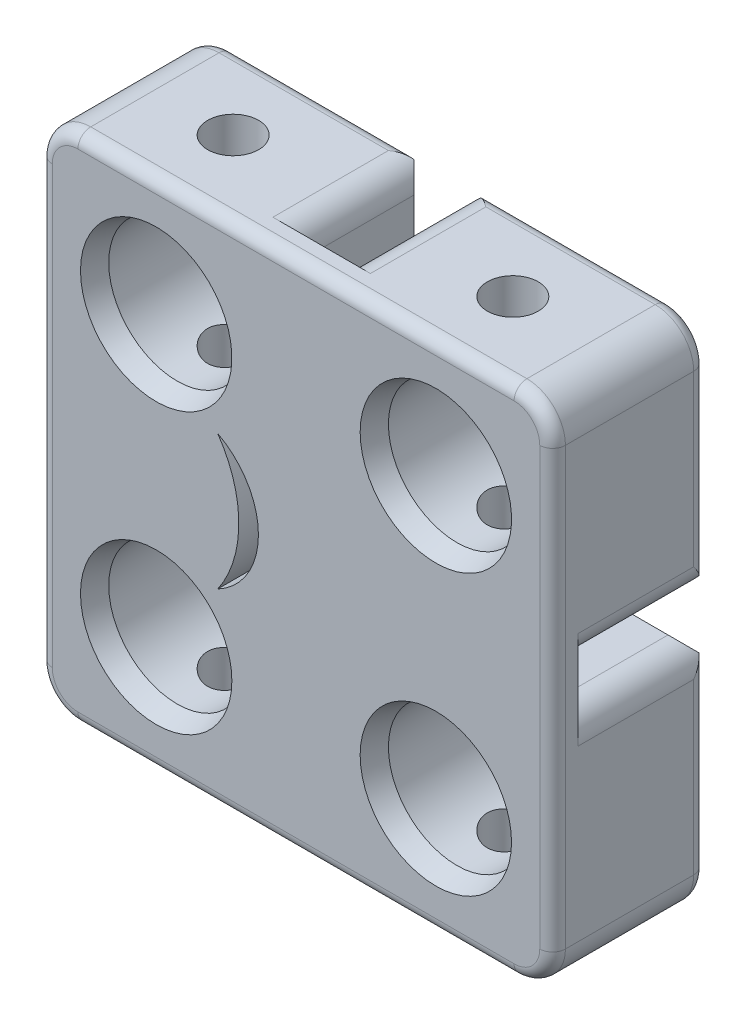
from build123d import *

# Parameters (mm, degrees)
SKETCH1_W           = 50.8
SKETCH1_H           = 50.8
BOSS_EXTRUDE1_DEPTH = 15.24
CUT_EXTRUDE1_DEPTH  = 12.7
SKETCH3_R           = 2.521712
CUT_EXTRUDE2_DEPTH  = 74.440708058
SKETCH4_R           = 6.773333333
CUT_EXTRUDE3_DEPTH  = 74.440708058
CUT_EXTRUDE4_DEPTH  = 12.7
CUT_EXTRUDE7_DEPTH  = 74.440708148
CHAMFER1_SIZE       = 1.27
FILLET2_R           = 1.27
FILLET3_R           = 3.81
FILLET4_R           = 2.54


with BuildPart() as part:
    # Sketch1 → Boss-Extrude1 (new body)
    with BuildSketch(Plane.XY):
        with Locations((25.4, 25.4)):
            Rectangle(SKETCH1_W, SKETCH1_H)
    extrude(amount=BOSS_EXTRUDE1_DEPTH)

    # Sketch2 → Cut-Extrude1 (cut)
    with BuildSketch(Plane(origin=(0, 0, 0), x_dir=(-1, 0, 0), z_dir=(0, 0, -1))):
        Polygon((-27.686, 50.8), (-23.114, 50.8), (-23.114, 27.686), (0, 27.686), (0, 23.114), (-23.114, 23.114), (-23.114, 0), (-27.686, 0), (-27.686, 23.114), (-50.8, 23.114), (-50.8, 27.686), (-27.686, 27.686), align=None)
    extrude(amount=-CUT_EXTRUDE1_DEPTH, mode=Mode.SUBTRACT)

    # Sketch3 → Cut-Extrude2 (cut, through all)
    with BuildSketch(Plane(origin=(0, 50.8, 0), x_dir=(1, 0, 0), z_dir=(0, 1, 0))):
        with Locations(Location((11.557, -7.62, 0), (0, 0, 270))):
            Circle(SKETCH3_R)
        with Locations(Location((39.243, -7.62, 0), (0, 0, 270))):
            Circle(SKETCH3_R)
    extrude(amount=-CUT_EXTRUDE2_DEPTH, mode=Mode.SUBTRACT)

    # Sketch4 → Cut-Extrude3 (cut, through all)
    with BuildSketch(Plane(origin=(0, 0, 0), x_dir=(-1, 0, 0), z_dir=(0, 0, -1))):
        with Locations((-39.243, 39.243)):
            Circle(SKETCH4_R)
        with Locations((-11.557, 39.243)):
            Circle(SKETCH4_R)
        with Locations((-11.557, 11.557)):
            Circle(SKETCH4_R)
        with Locations((-39.243, 11.557)):
            Circle(SKETCH4_R)
    extrude(amount=-CUT_EXTRUDE3_DEPTH, mode=Mode.SUBTRACT)

    # Sketch5 → Cut-Extrude4 (cut)
    with BuildSketch(Plane(origin=(0, 0, 0), x_dir=(-1, 0, 0), z_dir=(0, 0, -1))):
        Polygon((-25.4, 32.584204897), (-32.584204897, 25.4), (-25.4, 18.215795103), (-18.215795103, 25.4), align=None)
    extrude(amount=-CUT_EXTRUDE4_DEPTH, mode=Mode.SUBTRACT)

    # Sketch6 → Cut-Extrude7 (cut, through all)
    with BuildSketch(Plane.XY.offset(15.24)):
        with BuildLine():
            ThreePointArc((17.643786224, 32.072270857), (19.737124378, 25.4), (17.643786224, 18.727729143))
            ThreePointArc((17.643786224, 18.727729143), (21.677945484, 25.4), (17.643786224, 32.072270857))
        make_face()
    extrude(amount=-CUT_EXTRUDE7_DEPTH, mode=Mode.SUBTRACT)

    # Sketch10 → Cut-Revolve1 (revolve, cut)
    with BuildSketch(Plane(origin=(11.557, 0, 0), x_dir=(0, 0, -1), z_dir=(1, 0, 0)), mode=Mode.PRIVATE) as cut_revolve1_sk:
        Polygon((-15.24, 45.593), (-11.938, 45.593), (-15.24, 46.736), align=None)
    revolve(cut_revolve1_sk.sketch.rotate(Axis((11.557, 39.243, 0), (0, 0, 1)), 90), axis=Axis((11.557, 39.243, 0), (0, 0, 1)), mode=Mode.SUBTRACT)

    # Sketch13 → Cut-Revolve2 (revolve, cut)
    with BuildSketch(Plane(origin=(11.557, 0, 0), x_dir=(0, 0, -1), z_dir=(1, 0, 0)), mode=Mode.PRIVATE) as cut_revolve2_sk:
        Polygon((-15.24, 17.907), (-11.938, 17.907), (-15.24, 19.05), align=None)
    revolve(cut_revolve2_sk.sketch.rotate(Axis((11.557, 11.557, 0), (0, 0, 1)), 90), axis=Axis((11.557, 11.557, 0), (0, 0, 1)), mode=Mode.SUBTRACT)

    # Sketch14 → Cut-Revolve3 (revolve, cut)
    with BuildSketch(Plane.ZY.offset(-39.243), mode=Mode.PRIVATE) as cut_revolve3_sk:
        Polygon((11.938, 45.593), (15.24, 45.593), (15.24, 46.736), align=None)
    revolve(cut_revolve3_sk.sketch.rotate(Axis((39.243, 39.243, 0), (0, 0, 1)), 90), axis=Axis((39.243, 39.243, 0), (0, 0, 1)), mode=Mode.SUBTRACT)

    # Sketch15 → Cut-Revolve4 (revolve, cut)
    with BuildSketch(Plane.ZY.offset(-39.243), mode=Mode.PRIVATE) as cut_revolve4_sk:
        Polygon((15.24, 17.907), (11.938, 17.907), (15.24, 19.05), align=None)
    revolve(cut_revolve4_sk.sketch.rotate(Axis((39.243, 11.557, 0), (0, 0, 1)), 90), axis=Axis((39.243, 11.557, 0), (0, 0, 1)), mode=Mode.SUBTRACT)

    # Chamfer1
    chamfer1_edges = [part.edges().sort_by_distance(p)[0] for p in [
        (40.549102448, 27.686, 0),
        (27.686, 10.250897552, 0),
        (23.114, 40.549102448, 0),
        (22.108442913, 21.507352191, 0),
        (28.992102448, 21.807897552, 0),
        (28.992102448, 28.992102448, 0),
        (22.108442913, 29.292647809, 0),
        (9.755618574, 23.114, 0),
        (27.686, 40.549102448, 0),
        (40.549102448, 23.114, 0),
        (23.114, 10.250897552, 0),
        (9.755618574, 27.686, 0),
    ]]
    chamfer(chamfer1_edges, length=CHAMFER1_SIZE)

    # Fillet2
    fillet2_edges = [part.edges().sort_by_distance(p)[0] for p in [
        (10.922, 0, 0),
        (0, 10.922, 0),
        (0, 39.878, 0),
        (10.922, 50.8, 0),
        (39.878, 50.8, 0),
        (50.8, 39.878, 0),
        (39.878, 0, 0),
        (50.8, 10.922, 0),
        (0, 25.4, 15.24),
        (50.8, 25.4, 15.24),
        (25.4, 0, 15.24),
        (25.4, 50.8, 15.24),
    ]]
    fillet(fillet2_edges, radius=FILLET2_R)

    # Fillet3
    # the kernel refuses this fillet: 3.81 mm, written as the material it takes off along each edge
    with BuildSketch(Plane(origin=(3.81, 3.81, 0), x_dir=(0, -1, 0), z_dir=(1, 0, 0))) as fillet3_piece_1:
        with BuildLine():
            CenterArc((2.54, -1.27), 1.27, 0, 90)
            Line((3.81, -1.27), (3.81, 0))
            Line((3.81, 0), (2.54, 0))
        make_face()
    revolve(axis=Axis((3.81, 3.81, 0), (0, 0, -1)), revolution_arc=90, mode=Mode.SUBTRACT)
    with BuildSketch(Plane(origin=(3.81, 46.99, 0), x_dir=(-1, 0, 0), z_dir=(0, -1, 0))) as fillet3_piece_2:
        with BuildLine():
            CenterArc((2.54, -1.27), 1.27, 0, 90)
            Line((3.81, -1.27), (3.81, 0))
            Line((3.81, 0), (2.54, 0))
        make_face()
    revolve(axis=Axis((3.81, 46.99, 0), (0, 0, -1)), revolution_arc=90, mode=Mode.SUBTRACT)
    with BuildSketch(Plane(origin=(46.99, 46.99, 0), x_dir=(0, 1, 0), z_dir=(-1, 0, 0))) as fillet3_piece_3:
        with BuildLine():
            CenterArc((2.54, -1.27), 1.27, 0, 90)
            Line((3.81, -1.27), (3.81, 0))
            Line((3.81, 0), (2.54, 0))
        make_face()
    revolve(axis=Axis((46.99, 46.99, 0), (0, 0, -1)), revolution_arc=90, mode=Mode.SUBTRACT)
    with BuildSketch(Plane(origin=(46.99, 3.81, 0), x_dir=(1, 0, 0), z_dir=(0, 1, 0))) as fillet3_piece_4:
        with BuildLine():
            CenterArc((2.54, -1.27), 1.27, 0, 90)
            Line((3.81, -1.27), (3.81, 0))
            Line((3.81, 0), (2.54, 0))
        make_face()
    revolve(axis=Axis((46.99, 3.81, 0), (0, 0, -1)), revolution_arc=90, mode=Mode.SUBTRACT)
    with BuildSketch(Plane(origin=(46.99, 46.99, 15.24), x_dir=(1, 0, 0), z_dir=(0, -1, 0))) as fillet3_piece_5:
        with BuildLine():
            CenterArc((2.54, -1.27), 1.27, 0, 90)
            Line((3.81, -1.27), (3.81, 0))
            Line((3.81, 0), (2.54, 0))
        make_face()
    revolve(axis=Axis((46.99, 46.99, 15.24), (0, 0, 1)), revolution_arc=90, mode=Mode.SUBTRACT)
    with BuildSketch(Plane(origin=(46.99, 3.81, 15.24), x_dir=(0, -1, 0), z_dir=(-1, 0, 0))) as fillet3_piece_6:
        with BuildLine():
            CenterArc((2.54, -1.27), 1.27, 0, 90)
            Line((3.81, -1.27), (3.81, 0))
            Line((3.81, 0), (2.54, 0))
        make_face()
    revolve(axis=Axis((46.99, 3.81, 15.24), (0, 0, 1)), revolution_arc=90, mode=Mode.SUBTRACT)
    with BuildSketch(Plane(origin=(3.81, 46.99, 15.24), x_dir=(0, 1, 0), z_dir=(1, 0, 0))) as fillet3_piece_7:
        with BuildLine():
            CenterArc((2.54, -1.27), 1.27, 0, 90)
            Line((3.81, -1.27), (3.81, 0))
            Line((3.81, 0), (2.54, 0))
        make_face()
    revolve(axis=Axis((3.81, 46.99, 15.24), (0, 0, 1)), revolution_arc=90, mode=Mode.SUBTRACT)
    with BuildSketch(Plane(origin=(3.81, 3.81, 15.24), x_dir=(-1, 0, 0), z_dir=(0, 1, 0))) as fillet3_piece_8:
        with BuildLine():
            CenterArc((2.54, -1.27), 1.27, 0, 90)
            Line((3.81, -1.27), (3.81, 0))
            Line((3.81, 0), (2.54, 0))
        make_face()
    revolve(axis=Axis((3.81, 3.81, 15.24), (0, 0, 1)), revolution_arc=90, mode=Mode.SUBTRACT)
    with BuildSketch(Plane(origin=(50.8, 0, 0), x_dir=(-1, 0, 0), z_dir=(0, 0, 1)), Plane(origin=(50.8, 50.8, 0), x_dir=(0, -1, 0), z_dir=(0, 0, 1))) as fillet3_piece_9:
        with BuildLine():
            CenterArc((FILLET3_R, -FILLET3_R), FILLET3_R, 90, 90)
            Line((0, -FILLET3_R), (0, 0))
            Line((0, 0), (FILLET3_R, 0))
        make_face()
    extrude(amount=15.24, mode=Mode.SUBTRACT)
    with BuildSketch(Plane(origin=(0, 0, 0), x_dir=(1, 0, 0), z_dir=(0, 0, 1)), Plane(origin=(0, 50.8, 0), x_dir=(0, -1, 0), z_dir=(0, 0, 1))) as fillet3_piece_10:
        with BuildLine():
            CenterArc((FILLET3_R, FILLET3_R), FILLET3_R, 180, 90)
            Line((0, FILLET3_R), (0, 0))
            Line((0, 0), (FILLET3_R, 0))
        make_face()
    extrude(amount=15.24, mode=Mode.SUBTRACT)

    # Fillet4
    # the kernel refuses this fillet: 2.54 mm, written as the material it takes off along each edge
    with BuildSketch(Plane(origin=(0, 23.114, -5.08), x_dir=(0, -1, 0), z_dir=(0, 0, 1)), Plane(origin=(27.686, 0, -5.08), x_dir=(1, 0, 0), z_dir=(0, 0, 1))) as fillet4_piece_1:
        with BuildLine():
            CenterArc((FILLET4_R, FILLET4_R), FILLET4_R, 180, 90)
            Line((0, FILLET4_R), (0, 0))
            Line((0, 0), (FILLET4_R, 0))
        make_face()
    extrude(amount=17.78, mode=Mode.SUBTRACT)
    with BuildSketch(Plane(origin=(0, 27.686, -5.08), x_dir=(0, 1, 0), z_dir=(0, 0, 1)), Plane(origin=(23.114, 50.8, -5.08), x_dir=(0, -1, 0), z_dir=(0, 0, 1)), Plane(origin=(50.8, 23.114, -5.08), x_dir=(0, -1, 0), z_dir=(0, 0, 1)), Plane(origin=(50.8, 27.686, -5.08), x_dir=(-1, 0, 0), z_dir=(0, 0, 1)), Plane(origin=(27.686, 50.8, -5.08), x_dir=(1, 0, 0), z_dir=(0, 0, 1)), Plane(origin=(23.114, 0, -5.08), x_dir=(-1, 0, 0), z_dir=(0, 0, 1))) as fillet4_piece_2:
        with BuildLine():
            CenterArc((FILLET4_R, -FILLET4_R), FILLET4_R, 90, 90)
            Line((0, -FILLET4_R), (0, 0))
            Line((0, 0), (FILLET4_R, 0))
        make_face()
    extrude(amount=17.78, mode=Mode.SUBTRACT)


solid = part.part
